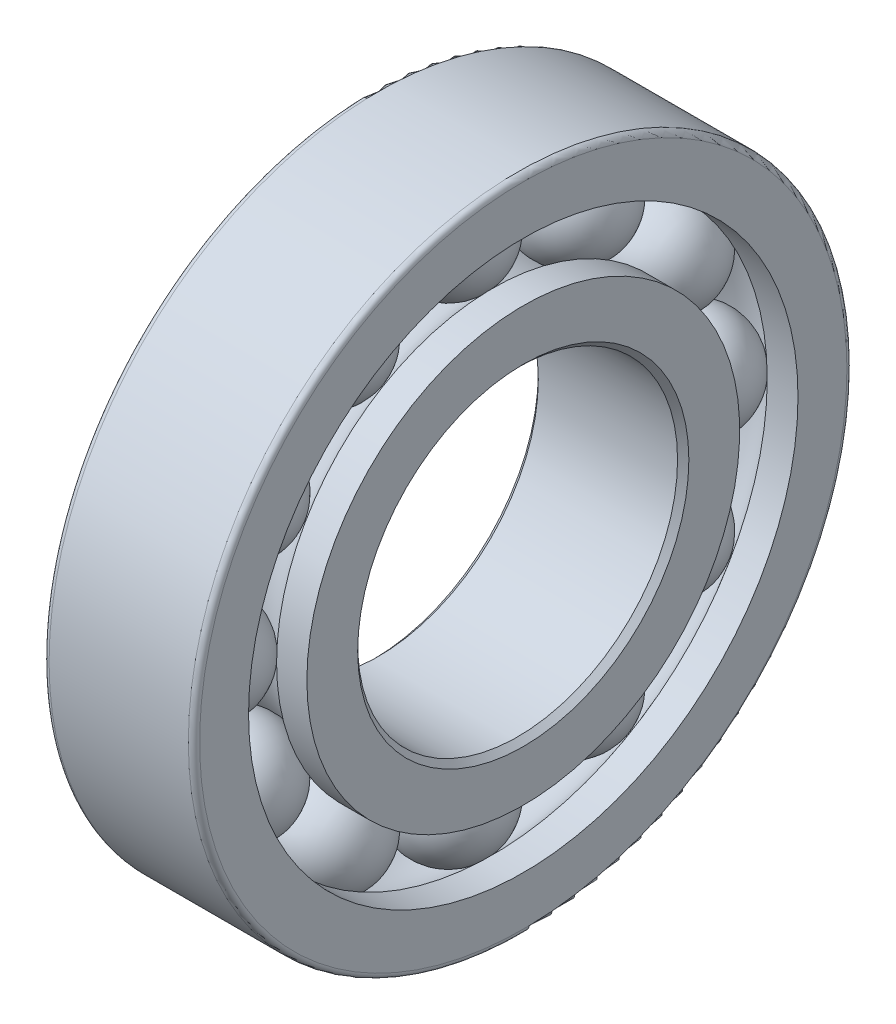
from build123d import *

# Parameters (mm, degrees)
CIRPATTERN3_COUNT = 12
FILLET1_R         = 0.3
CHAMFER1_SIZE     = 0.3


with BuildPart() as part:
    # Sketch1 → Revolve1 (revolve)
    with BuildSketch(Plane(origin=(0, 0, 0), x_dir=(1, 0, 0), z_dir=(0, 1, 0))):
        with BuildLine():
            Line((4, 14.6), (4, 17.5))
            Line((4, 17.5), (-4, 17.5))
            Line((-4, 17.5), (-4, 14.6))
            Line((-4, 14.6), (-2.365104403, 14.6))
            ThreePointArc((-2.365104403, 14.6), (0, 15.869278981), (2.365104403, 14.6))
            Line((2.365104403, 14.6), (4, 14.6))
        make_face()
        with BuildLine():
            ThreePointArc((2.389700722, 11.5), (0, 10.192994985), (-2.389700722, 11.5))
            Line((-2.389700722, 11.5), (-4, 11.5))
            Line((-4, 11.5), (-4, 8.5))
            Line((-4, 8.5), (4, 8.5))
            Line((4, 8.5), (4, 11.5))
            Line((4, 11.5), (2.389700722, 11.5))
        make_face()
    revolve(axis=Axis((-25.30672907, 0, 0), (1, 0, 0)))

    # Fillet1
    fillet1_edges = [part.edges().sort_by_distance(p)[0] for p in [
        (4, 0, 17.5),
        (-4, 0, 17.5),
    ]]
    fillet(fillet1_edges, radius=FILLET1_R)

    # Chamfer1
    chamfer1_edges = [part.edges().sort_by_distance(p)[0] for p in [
        (4, 0, 8.5),
        (-4, 0, 8.5),
    ]]
    chamfer(chamfer1_edges, length=CHAMFER1_SIZE)


with BuildPart() as body_2:
    # Sketch2 → Revolve2 (revolve)
    with BuildSketch(Plane.XY):
        with BuildLine():
            Line((-2.8, 13.03), (2.8, 13.03))
            ThreePointArc((2.8, 13.03), (0, 15.83), (-2.8, 13.03))
        make_face()
    revolve(axis=Axis((2.8, 13.03, 0), (-1, 0, 0)))


with BuildPart() as cirpattern3_1:
    # CirPattern3: pattern copy
    add(body_2.part.rotate(Axis((4, 0, 0), (-1, 0, 0)), 1 * 360 / CIRPATTERN3_COUNT))


with BuildPart() as cirpattern3_2:
    # CirPattern3: pattern copy
    add(body_2.part.rotate(Axis((4, 0, 0), (-1, 0, 0)), 2 * 360 / CIRPATTERN3_COUNT))


with BuildPart() as cirpattern3_3:
    # CirPattern3: pattern copy
    add(body_2.part.rotate(Axis((4, 0, 0), (-1, 0, 0)), 3 * 360 / CIRPATTERN3_COUNT))


with BuildPart() as cirpattern3_4:
    # CirPattern3: pattern copy
    add(body_2.part.rotate(Axis((4, 0, 0), (-1, 0, 0)), 4 * 360 / CIRPATTERN3_COUNT))


with BuildPart() as cirpattern3_5:
    # CirPattern3: pattern copy
    add(body_2.part.rotate(Axis((4, 0, 0), (-1, 0, 0)), 5 * 360 / CIRPATTERN3_COUNT))


with BuildPart() as cirpattern3_6:
    # CirPattern3: pattern copy
    add(body_2.part.rotate(Axis((4, 0, 0), (-1, 0, 0)), 6 * 360 / CIRPATTERN3_COUNT))


with BuildPart() as cirpattern3_7:
    # CirPattern3: pattern copy
    add(body_2.part.rotate(Axis((4, 0, 0), (-1, 0, 0)), 7 * 360 / CIRPATTERN3_COUNT))


with BuildPart() as cirpattern3_8:
    # CirPattern3: pattern copy
    add(body_2.part.rotate(Axis((4, 0, 0), (-1, 0, 0)), 8 * 360 / CIRPATTERN3_COUNT))


with BuildPart() as cirpattern3_9:
    # CirPattern3: pattern copy
    add(body_2.part.rotate(Axis((4, 0, 0), (-1, 0, 0)), 9 * 360 / CIRPATTERN3_COUNT))


with BuildPart() as cirpattern3_10:
    # CirPattern3: pattern copy
    add(body_2.part.rotate(Axis((4, 0, 0), (-1, 0, 0)), 10 * 360 / CIRPATTERN3_COUNT))


with BuildPart() as cirpattern3_11:
    # CirPattern3: pattern copy
    add(body_2.part.rotate(Axis((4, 0, 0), (-1, 0, 0)), 11 * 360 / CIRPATTERN3_COUNT))


solid = Compound([part.part, body_2.part, cirpattern3_1.part, cirpattern3_2.part, cirpattern3_3.part, cirpattern3_4.part, cirpattern3_5.part, cirpattern3_6.part, cirpattern3_7.part, cirpattern3_8.part, cirpattern3_9.part, cirpattern3_10.part, cirpattern3_11.part])
